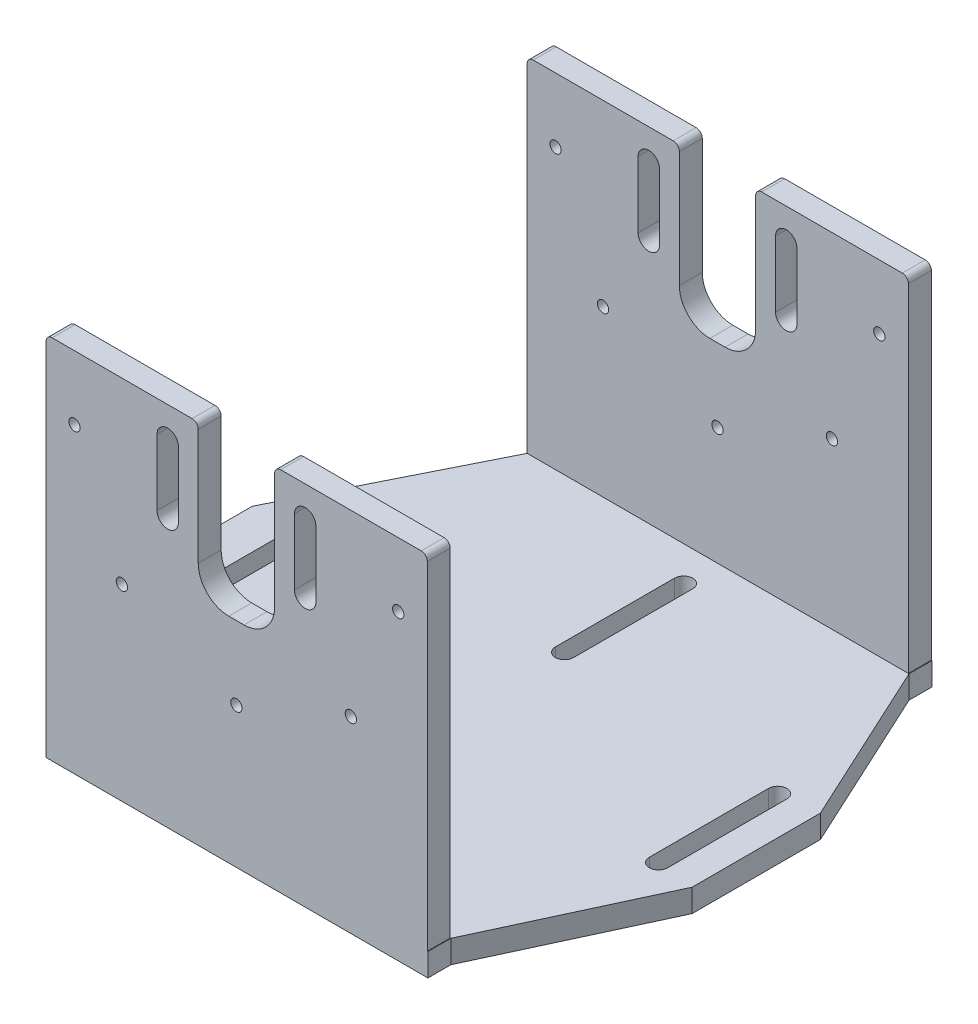
from build123d import *

# Parameters (mm, degrees)
BOSS_EXTRUDE6_DEPTH = 7.5
SKETCH2_R           = 1.85
BOSS_EXTRUDE7_DEPTH = 7.5


with BuildPart() as part:
    # Sketch1 → Boss-Extrude6 (new body)
    with BuildSketch(Plane(origin=(0, 0, 0), x_dir=(1, 0, 0), z_dir=(0, 1, 0))):
        Polygon((0, -7.5), (125, -7.5), (125, 0), (150, 54), (150, 96), (125, 150), (125, 157.5), (0, 157.5), (0, 150), (-30, 90), (-30, 60), (0, 0), align=None)
        with BuildLine():
            Line((134.5, 55.5), (134.5, 94.5))
            ThreePointArc((134.5, 94.5), (137.5, 97.5), (140.5, 94.5))
            Line((140.5, 94.5), (140.5, 55.5))
            ThreePointArc((140.5, 55.5), (137.5, 52.5), (134.5, 55.5))
        make_face(mode=Mode.SUBTRACT)
        with BuildLine():
            Line((-17, 55.5), (-17, 94.5))
            ThreePointArc((-17, 94.5), (-14, 97.5), (-11, 94.5))
            Line((-11, 94.5), (-11, 55.5))
            ThreePointArc((-11, 55.5), (-14, 52.5), (-17, 55.5))
        make_face(mode=Mode.SUBTRACT)
        with BuildLine():
            Line((59.5, 11), (59.5, 50))
            ThreePointArc((59.5, 50), (62.5, 53), (65.5, 50))
            Line((65.5, 50), (65.5, 11))
            ThreePointArc((65.5, 11), (62.5, 8), (59.5, 11))
        make_face(mode=Mode.SUBTRACT)
        with BuildLine():
            Line((65.5, 138.705746838), (65.5, 99.705746838))
            ThreePointArc((65.5, 99.705746838), (62.5, 96.705746838), (59.5, 99.705746838))
            Line((59.5, 99.705746838), (59.5, 138.705746838))
            ThreePointArc((59.5, 138.705746838), (62.5, 141.705746839), (65.5, 138.705746838))
        make_face(mode=Mode.SUBTRACT)
    extrude(amount=BOSS_EXTRUDE6_DEPTH)

    # Sketch2 → Boss-Extrude7 (add)
    with BuildSketch(Plane.XY):
        with BuildLine():
            Line((0, 0), (0, 118))
            ThreePointArc((0, 118), (0.585786438, 119.414213562), (2, 120))
            Line((2, 120), (47.812758192, 120))
            ThreePointArc((47.812758192, 120), (49.226971755, 119.414213562), (49.812758192, 118))
            Line((49.812758192, 118), (49.812758192, 80))
            ThreePointArc((49.812758192, 80), (52.74169038, 72.928932188), (59.812758192, 70))
            Line((59.812758192, 70), (64.812758192, 70))
            ThreePointArc((64.812758192, 70), (71.883826004, 72.928932188), (74.812758192, 80))
            Line((74.812758192, 80), (74.812758192, 118))
            ThreePointArc((74.812758192, 118), (75.39854463, 119.414213562), (76.812758192, 120))
            Line((76.812758192, 120), (122.812758192, 120))
            ThreePointArc((122.812758192, 120), (124.226971755, 119.414213562), (124.812758192, 118))
            Line((124.812758192, 118), (124.812758192, 0))
            Line((124.812758192, 0), (0, 0))
        make_face()
        with Locations((115.293642293, 99)):
            Circle(SKETCH2_R, mode=Mode.SUBTRACT)
        with Locations((99.770301696, 61.523340597)):
            Circle(SKETCH2_R, mode=Mode.SUBTRACT)
        with Locations((62.293642293, 46)):
            Circle(SKETCH2_R, mode=Mode.SUBTRACT)
        with Locations((24.81698289, 61.523340597)):
            Circle(SKETCH2_R, mode=Mode.SUBTRACT)
        with Locations((9.293642293, 99)):
            Circle(SKETCH2_R, mode=Mode.SUBTRACT)
        with BuildLine():
            Line((36.312758192, 88.190430343), (36.312758192, 109.809569657))
            ThreePointArc((36.312758192, 109.809569657), (39.812758192, 113.309569657), (43.312758192, 109.809569657))
            Line((43.312758192, 109.809569657), (43.312758192, 88.190430343))
            ThreePointArc((43.312758192, 88.190430343), (39.812758192, 84.690430343), (36.312758192, 88.190430343))
        make_face(mode=Mode.SUBTRACT)
        with BuildLine():
            Line((88.312758192, 88.190430343), (88.312758192, 109.809569657))
            ThreePointArc((88.312758192, 109.809569657), (84.812758192, 113.309569657), (81.312758192, 109.809569657))
            Line((81.312758192, 109.809569657), (81.312758192, 88.190430343))
            ThreePointArc((81.312758192, 88.190430343), (84.812758192, 84.690430343), (88.312758192, 88.190430343))
        make_face(mode=Mode.SUBTRACT)
    boss_extrude7 = extrude(amount=BOSS_EXTRUDE7_DEPTH)

    # Mirror1: Boss-Extrude7 across plane
    add(boss_extrude7.mirror(Plane(origin=(0, 0, -75), x_dir=(1, 0, 0), z_dir=(0, 0, -1))))


solid = part.part
